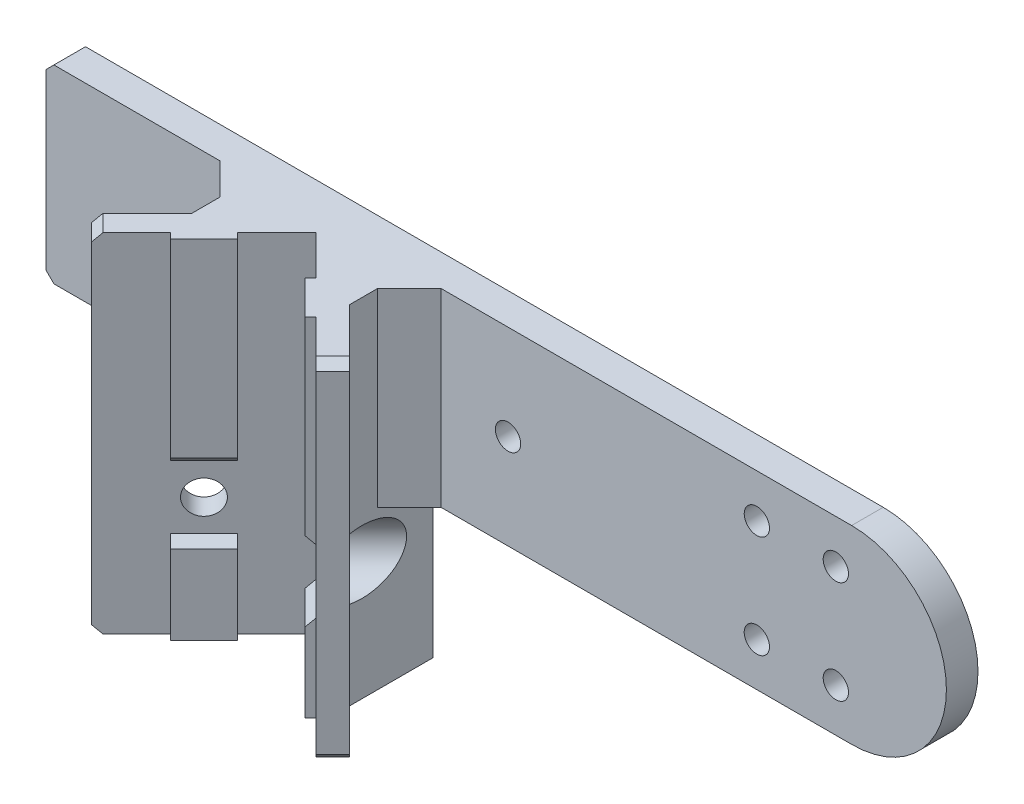
from build123d import *

# Parameters (mm, degrees)
CROQUIS1_R                 = 1.6
SALIENTE_EXTRUIR1_DEPTH    = 4
CROQUIS3_R                 = 1.6
SALIENTE_EXTRUIR3_DEPTH    = 4
SALIENTE_EXTRUIR4_DEPTH    = 44
CORTAR_EXTRUIR1_START      = -2
CORTAR_EXTRUIR1_DEPTH      = 4
MATRIZL1_COUNT             = 2
MATRIZL1_PITCH             = 10
CORTAR_EXTRUIR2_DEPTH      = 86.777797157
CORTAR_EXTRUIR2_DEPTH_BACK = 86.777797157
CROQUIS7_R                 = 2.1
CROQUIS8_R                 = 4
CORTAR_EXTRUIR3_DEPTH      = 86.777797157
CORTAR_EXTRUIR4_DEPTH      = 88.170949948
CORTAR_EXTRUIR4_DEPTH_BACK = 88.170949948
CROQUIS9_R                 = 2.1
CROQUIS10_R                = 4
CORTAR_EXTRUIR5_DEPTH      = 88.170949948
CHAFL_N1_SIZE              = 4
CHAFL_N2_SIZE              = 1
CROQUIS11_W                = 6
CROQUIS11_H                = 8
CORTAR_EXTRUIR6_DEPTH      = 1
CROQUIS12_W                = 6
CROQUIS12_H                = 8
CORTAR_EXTRUIR7_DEPTH      = 1
CHAFL_N3_SIZE              = 1


with BuildPart() as part:
    # Croquis1 → Saliente-Extruir1 (new body)
    with BuildSketch(Plane.XY):
        Polygon((10, -12), (36, -12), (36, 12), (-36, 12), (-36, -12), (-10, -12), (-10, -32), (10, -32), align=None)
        with Locations((-22.5, 0)):
            Circle(CROQUIS1_R, mode=Mode.SUBTRACT)
        with Locations(Location((22.5, 0, 0), (0, 0, 180))):
            Circle(CROQUIS1_R, mode=Mode.SUBTRACT)
    extrude(amount=SALIENTE_EXTRUIR1_DEPTH)

    # Croquis3 → Saliente-Extruir3 (add)
    with BuildSketch(Plane(origin=(0, 0, 0), x_dir=(-1, 0, 0), z_dir=(0, 0, -1))):
        with BuildLine():
            Line((-66, 12), (-36, 12))
            Line((-36, 12), (-36, -12))
            Line((-36, -12), (-66, -12))
            ThreePointArc((-66, -12), (-78, 0), (-66, 12))
        make_face()
        with Locations((-54, 6.5)):
            Circle(CROQUIS3_R, mode=Mode.SUBTRACT)
        with Locations((-64, 6.5)):
            Circle(CROQUIS3_R, mode=Mode.SUBTRACT)
        with Locations(Location((-54, -6.5, 0), (0, 0, 180))):
            Circle(CROQUIS3_R, mode=Mode.SUBTRACT)
        with Locations(Location((-64, -6.5, 0), (0, 0, 180))):
            Circle(CROQUIS3_R, mode=Mode.SUBTRACT)
    extrude(amount=-SALIENTE_EXTRUIR3_DEPTH)

    # Croquis5 → Saliente-Extruir4 (add, through all)
    with BuildSketch(Plane(origin=(0, 12, 0), x_dir=(1, 0, 0), z_dir=(0, 1, 0))):
        Polygon((-10, -11.544513011), (-10, -4), (10, -4), (10, -11.544513011), (16.334166645, -17.878679656), (14.212846302, -20), (9.227743494, -15.014897193), (8.520636713, -15.722003974), (4.277996026, -11.479363287), (4.985102807, -10.772256506), (0, -5.787153698), (-4.985102807, -10.772256506), (-4.277996026, -11.479363287), (-8.520636713, -15.722003974), (-9.227743494, -15.014897193), (-14.212846302, -20), (-16.334166645, -17.878679656), align=None)
    extrude(amount=-SALIENTE_EXTRUIR4_DEPTH)

    # Croquis6 → Cortar-Extruir1 (cut)
    with BuildSketch(Plane.XZ.offset(32).offset(CORTAR_EXTRUIR1_START)):
        with BuildLine():
            Line((-4.48819847, 0), (-7.48819847, 0))
            ThreePointArc((-7.48819847, 0), (-6.174348725, 3.177805305), (-3, 4.499984525))
            Line((-3, 4.499984525), (3, 4.499984525))
            ThreePointArc((3, 4.499984525), (6.174348725, 3.177805305), (7.48819847, 0))
            Line((7.48819847, 0), (4.48819847, 0))
            ThreePointArc((4.48819847, 0), (4.036842813, 1.072541394), (2.954405081, 1.499619287))
            Line((2.954405081, 1.499619287), (-2.954405081, 1.499619287))
            ThreePointArc((-2.954405081, 1.499619287), (-4.036842813, 1.072541394), (-4.48819847, 0))
        make_face()
    cortar_extruir1 = extrude(amount=-CORTAR_EXTRUIR1_DEPTH, mode=Mode.SUBTRACT)

    # MatrizL1: Cortar-Extruir1 ×2
    with Locations(*[(0, i * MATRIZL1_PITCH, 0) for i in range(1, MATRIZL1_COUNT)]):
        add(cortar_extruir1, mode=Mode.SUBTRACT)

    # Croquis7 → Cortar-Extruir2 (cut, two sides: drawn at the far end of the back side and taken through both)
    with BuildSketch(Plane(origin=(0.772256506, 0, 0.772256506), x_dir=(-0.7071067811865476, 0, 0.7071067811865476), z_dir=(-0.7071067811865476, 0, -0.7071067811865476)).offset(-CORTAR_EXTRUIR2_DEPTH_BACK)):
        with Locations(Location((14.142135624, -17, 0), (0, 0, 58.663416321))):
            Circle(CROQUIS7_R)
    extrude(amount=CORTAR_EXTRUIR2_DEPTH + CORTAR_EXTRUIR2_DEPTH_BACK, mode=Mode.SUBTRACT)

    # Croquis8 → Cortar-Extruir3 (cut, through all)
    with BuildSketch(Plane(origin=(0.772256506, 0, 0.772256506), x_dir=(-0.7071067811865476, 0, 0.7071067811865476), z_dir=(-0.7071067811865476, 0, -0.7071067811865476))):
        with Locations((14.142135624, -17)):
            Circle(CROQUIS8_R)
    extrude(amount=CORTAR_EXTRUIR3_DEPTH, mode=Mode.SUBTRACT)

    # Croquis9 → Cortar-Extruir4 (cut, two sides: drawn at the far end of the back side and taken through both)
    with BuildSketch(Plane(origin=(-0.772256506, 0, 0.772256506), x_dir=(-0.7071067811865476, 0, -0.7071067811865476), z_dir=(0.7071067811865476, 0, -0.7071067811865476)).offset(-CORTAR_EXTRUIR4_DEPTH_BACK)):
        with Locations(Location((-14.142135624, -17, 0), (0, 0, 238.663416321))):
            Circle(CROQUIS9_R)
    extrude(amount=CORTAR_EXTRUIR4_DEPTH + CORTAR_EXTRUIR4_DEPTH_BACK, mode=Mode.SUBTRACT)

    # Croquis10 → Cortar-Extruir5 (cut, through all)
    with BuildSketch(Plane(origin=(-0.772256506, 0, 0.772256506), x_dir=(-0.7071067811865476, 0, -0.7071067811865476), z_dir=(0.7071067811865476, 0, -0.7071067811865476))):
        with Locations((-14.142135624, -17)):
            Circle(CROQUIS10_R)
    extrude(amount=CORTAR_EXTRUIR5_DEPTH, mode=Mode.SUBTRACT)

    # Chaflán1
    chafl_n1_edges = [part.edges().sort_by_distance(p)[0] for p in [
        (-10, 0, 4),
        (10, 0, 4),
    ]]
    chamfer(chafl_n1_edges, length=CHAFL_N1_SIZE)

    # Chaflán2
    chafl_n2_edges = [part.edges().sort_by_distance(p)[0] for p in [
        (-36, -12, 2),
        (-36, 12, 2),
        (-15.273506474, -32, 18.939339828),
        (15.273506474, -32, 18.939339828),
        (15.273506474, 12, 18.939339828),
        (-15.273506474, 12, 18.939339828),
        (10, -22, 0),
        (0, -32, 0),
        (-10, -22, 0),
    ]]
    chamfer(chafl_n2_edges, length=CHAFL_N2_SIZE)

    # Croquis11 → Cortar-Extruir6 (cut)
    with BuildSketch(Plane(origin=(-3.60068363, 0, 3.60068363), x_dir=(0.7071067811865476, 0, 0.7071067811865476), z_dir=(-0.7071067811865476, 0, 0.7071067811865476))):
        with Locations((14.142135624, -17)):
            Rectangle(CROQUIS11_W, CROQUIS11_H)
    extrude(amount=-CORTAR_EXTRUIR6_DEPTH, mode=Mode.SUBTRACT)

    # Croquis12 → Cortar-Extruir7 (cut)
    with BuildSketch(Plane(origin=(3.60068363, 0, 3.60068363), x_dir=(0.7071067811865475, 0, -0.7071067811865477), z_dir=(0.7071067811865477, 0, 0.7071067811865475))):
        with Locations((-14.142135624, -17)):
            Rectangle(CROQUIS12_W, CROQUIS12_H)
    extrude(amount=-CORTAR_EXTRUIR7_DEPTH, mode=Mode.SUBTRACT)

    # Chaflán3
    chafl_n3_edges = [part.edges().sort_by_distance(p)[0] for p in [
        (-6.39931637, -21, 13.60068363),
        (6.39931637, -21, 13.60068363),
        (6.39931637, -13, 13.60068363),
        (-6.39931637, -13, 13.60068363),
    ]]
    chamfer(chafl_n3_edges, length=CHAFL_N3_SIZE - 0.0001)  # a hair under: the kernel refuses the full size


solid = part.part
